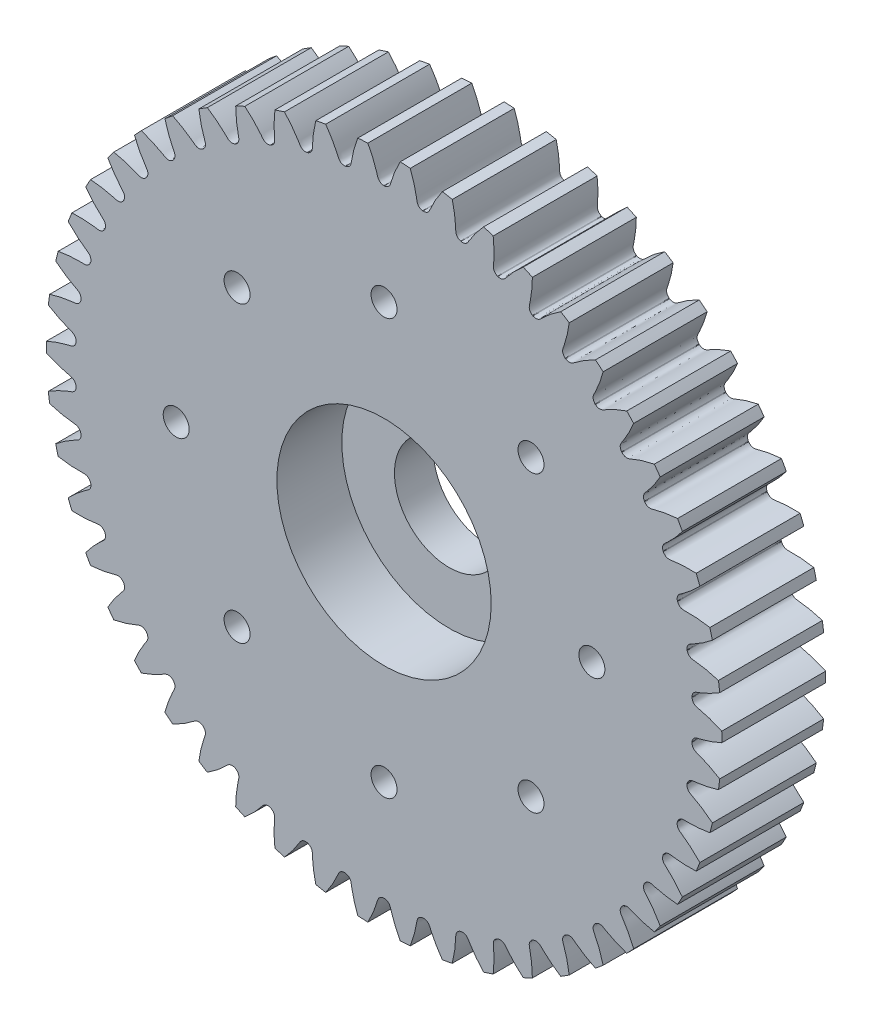
from build123d import *

# Parameters (mm, degrees)
SKETCH_1_R               = 26
SKETCH_1_R_2             = 1
EXTRUDE_1_DEPTH          = 8
CUT_EXTRUDE_1_DEPTH      = 38.629775444
PATTERN_CIRCULAR_1_COUNT = 50
SKETCH_4_R               = 8.25
CUT_EXTRUDE_2_DEPTH      = 5
SKETCH_5_R               = 4.2
CUT_EXTRUDE_3_DEPTH      = 4


with BuildPart() as part:
    # 草图1 → 凸台-拉伸1 (new body)
    with BuildSketch(Plane.XY):
        Circle(SKETCH_1_R)
        with Locations((0, 16)):
            Circle(SKETCH_1_R_2, mode=Mode.SUBTRACT)
        with Locations((11.313708499, 11.313708499)):
            Circle(SKETCH_1_R_2, mode=Mode.SUBTRACT)
        with Locations((16, 0)):
            Circle(SKETCH_1_R_2, mode=Mode.SUBTRACT)
        with Locations((11.313708499, -11.313708499)):
            Circle(SKETCH_1_R_2, mode=Mode.SUBTRACT)
        with Locations((0, -16)):
            Circle(SKETCH_1_R_2, mode=Mode.SUBTRACT)
        with Locations((-11.313708499, -11.313708499)):
            Circle(SKETCH_1_R_2, mode=Mode.SUBTRACT)
        with Locations((-16, 0)):
            Circle(SKETCH_1_R_2, mode=Mode.SUBTRACT)
        with Locations((-11.313708499, 11.313708499)):
            Circle(SKETCH_1_R_2, mode=Mode.SUBTRACT)
    extrude(amount=EXTRUDE_1_DEPTH)

    # 草图2 → 切除-拉伸1 (cut, through all)
    with BuildSketch(Plane.XY):
        with BuildLine():
            ThreePointArc((0.018256116, 23.749992983), (0, 23.75), (-0.018256116, 23.749992983))
            add(Edge.make_bspline(
                [(-0.018256116, 23.749992983), (-0.43502677, 23.80092954), (-0.488263226, 24.115542193), (-0.594784579, 24.458759502), (-0.638691863, 24.592940563), (-0.688543951, 24.734989822), (-0.744462101, 24.884847093), (-0.806838984, 25.04228552), (-0.875980734, 25.207114204), (-0.952211703, 25.379118875), (-1.035843516, 25.558079403), (-1.127183732, 25.7437649), (-1.226532997, 25.935935337), (-1.334185536, 26.134341284), (-1.45042869, 26.338724199), (-1.575542725, 26.548816571), (-1.709800577, 26.76434211), (-1.853467615, 26.98501593), (-2.006801408, 27.210544746), (-2.170051494, 27.440627072), (-2.343459158, 27.674953425), (-2.527257213, 27.913206537), (-2.721669781, 28.155061571), (-2.926912106, 28.400186342), (-3.143190259, 28.648241548), (-3.450749097, 28.987066304), (-3.692335855, 29.23747667), (-3.858794071, 29.403429001)],
                knots=[0, 0, 0, 0, 0.116496199, 0.135538346, 0.15593866, 0.177697141, 0.200813789, 0.225288605, 0.251121587, 0.278312737, 0.306862053, 0.336769537, 0.368035188, 0.400659005, 0.43464099, 0.469981142, 0.506679462, 0.544735948, 0.584150601, 0.624923421, 0.667054409, 0.710543564, 0.755390885, 0.801596374, 0.84916003, 0.898081853, 1, 1, 1, 1], degree=3))
            ThreePointArc((-3.858794071, 29.403429001), (0, 29.65555477), (3.858794071, 29.403429001))
            add(Edge.make_bspline(
                [(0.018256116, 23.749992983), (0.43502677, 23.80092954), (0.488263226, 24.115542193), (0.594784579, 24.458759502), (0.638691863, 24.592940563), (0.688543951, 24.734989822), (0.744462101, 24.884847093), (0.806838984, 25.04228552), (0.875980734, 25.207114204), (0.952211703, 25.379118875), (1.035843516, 25.558079403), (1.127183732, 25.7437649), (1.226532997, 25.935935337), (1.334185536, 26.134341284), (1.45042869, 26.338724199), (1.575542725, 26.548816571), (1.709800577, 26.76434211), (1.853467615, 26.98501593), (2.006801408, 27.210544746), (2.170051494, 27.440627072), (2.343459158, 27.674953425), (2.527257213, 27.913206537), (2.721669781, 28.155061571), (2.926912106, 28.400186342), (3.143190259, 28.648241548), (3.450749097, 28.987066304), (3.692335855, 29.23747667), (3.858794071, 29.403429001)],
                knots=[0, 0, 0, 0, 0.116496199, 0.135538346, 0.15593866, 0.177697141, 0.200813789, 0.225288605, 0.251121587, 0.278312737, 0.306862053, 0.336769537, 0.368035188, 0.400659005, 0.43464099, 0.469981142, 0.506679462, 0.544735948, 0.584150601, 0.624923421, 0.667054409, 0.710543564, 0.755390885, 0.801596374, 0.84916003, 0.898081853, 1, 1, 1, 1], degree=3))
        make_face()
    cut_extrude_1 = extrude(amount=CUT_EXTRUDE_1_DEPTH, mode=Mode.SUBTRACT)

    # 阵列(圆周)1: 切除-拉伸1 ×50 about axis
    pattern_circular_1_axis = Axis((0, 0, -1.5), (0, 0, 1))
    for i in range(1, PATTERN_CIRCULAR_1_COUNT):
        add(cut_extrude_1.rotate(pattern_circular_1_axis, i * 360 / PATTERN_CIRCULAR_1_COUNT), mode=Mode.SUBTRACT)

    # 草图4 → 切除-拉伸2 (cut)
    with BuildSketch(Plane.XY.offset(8)):
        Circle(SKETCH_4_R)
    extrude(amount=-CUT_EXTRUDE_2_DEPTH, mode=Mode.SUBTRACT)

    # 草图5 → 切除-拉伸3 (cut)
    with BuildSketch(Plane.XY.offset(3)):
        Circle(SKETCH_5_R)
    extrude(amount=-CUT_EXTRUDE_3_DEPTH, mode=Mode.SUBTRACT)


solid = part.part
